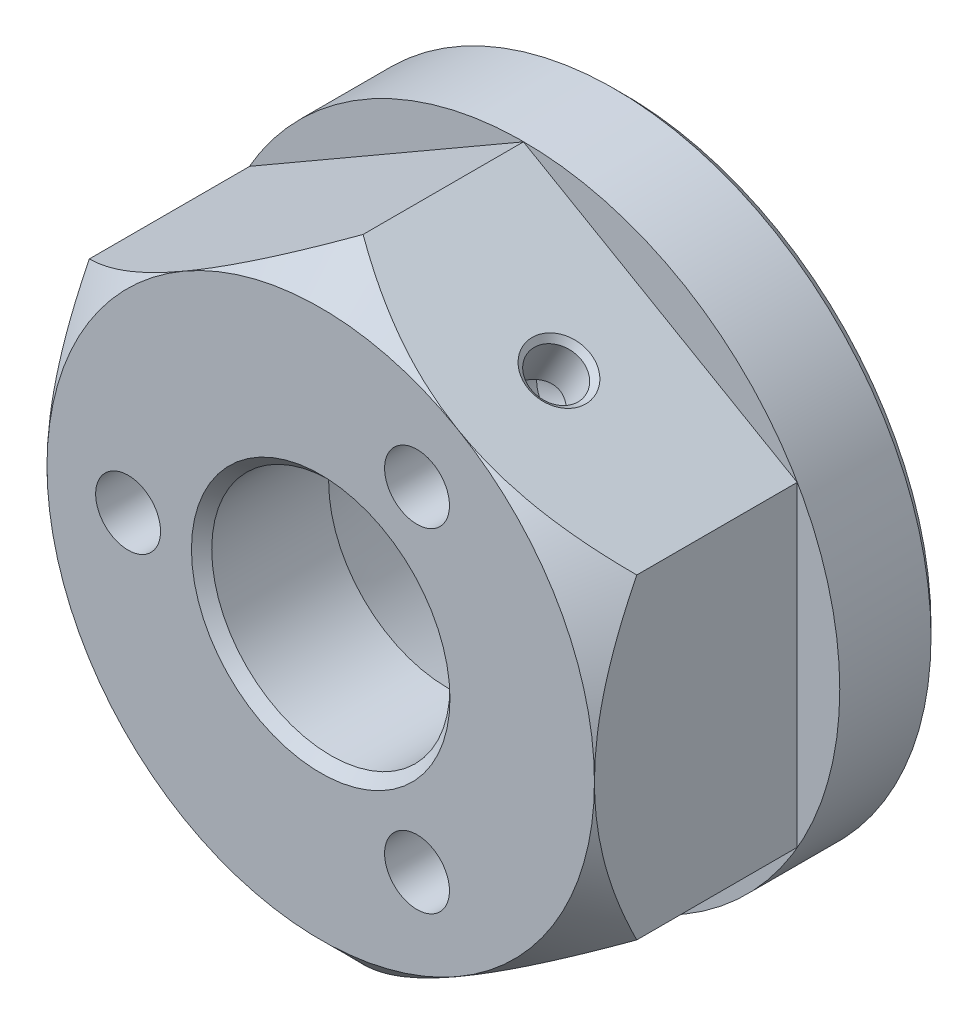
from build123d import *

# Parameters (mm, degrees)
ESQUISSE1_R                         = 15.6
ESQUISSE1_R_2                       = 10.25
BOSS_EXTRU_1_DEPTH                  = 5
ESQUISSE2_R                         = 15.6
ESQUISSE2_R_2                       = 5.875
BOSS_EXTRU_2_DEPTH                  = 10
CHANFREIN1_SIZE                     = 1
CHANFREIN1_SIZE2                    = 3.732050808
ENL_V_START                         = -10
ESQUISSE3_R                         = 15.6
ENL_V_MAT_EXTRU_1_DEPTH             = 10
CHANFREIN4_SIZE                     = 0.5
ESQUISSE15_R                        = 11.25
ENL_V_MAT_EXTRU_5_DEPTH             = 2.25
FILETAGE1_PITCH                     = 1.5
CHANFREIN9_SIZE                     = 0.5
CHANFREIN10_SIZE                    = 0.5
CHANFREIN10_SIZE2                   = 0.707106781
DIAM_TRE_DU_PER_AGE_3_2_3_2_1_D     = 3.2
DIAM_TRE_DU_PER_AGE_3_2_3_2_1_DEPTH = 7.5
DIAM_TRE_DU_PER_AGE_3_2_3_2_1_TIP   = 0.96137699


# Read off the part's stored shape, not the designer's step: Trou taraudé M3x0.51
with BuildPart() as part:
    # Esquisse1 → Boss.-Extru.1 (new body)
    with BuildSketch(Plane.XY):
        Circle(ESQUISSE1_R)
        Circle(ESQUISSE1_R_2, mode=Mode.SUBTRACT)
    extrude(amount=BOSS_EXTRU_1_DEPTH)

    # Esquisse2 → Boss.-Extru.2 (add)
    with BuildSketch(Plane.XY.offset(5)):
        Circle(ESQUISSE2_R)
        Circle(ESQUISSE2_R_2, mode=Mode.SUBTRACT)
    extrude(amount=BOSS_EXTRU_2_DEPTH)

    # Chanfrein1
    chanfrein1_edges = [part.edges().sort_by_distance(p)[0] for p in [
        (-5.875, 0, 5),
    ]]
    chanfrein1_side = [part.faces().sort_by_distance(p)[0] for p in [
        (-9.96008622, 0, 5),
    ]]
    chamfer(chanfrein1_edges, length=CHANFREIN1_SIZE, length2=CHANFREIN1_SIZE2, reference=chanfrein1_side[0])

    # Esquisse3 → Enlèv. mat.-Extru.1 (cut)
    with BuildSketch(Plane.XY.offset(15).offset(ENL_V_START)):
        Circle(ESQUISSE3_R)
        Polygon((-13.5, -7.794228634), (0, -15.588457268), (13.5, -7.794228634), (13.5, 7.794228634), (0, 15.588457268), (-13.5, 7.794228634), align=None, mode=Mode.SUBTRACT)
    extrude(amount=ENL_V_MAT_EXTRU_1_DEPTH, mode=Mode.SUBTRACT)

    # Chanfrein4
    chanfrein4_edges = [part.edges().sort_by_distance(p)[0] for p in [
        (-15.6, 0, 0),
    ]]
    chamfer(chanfrein4_edges, length=CHANFREIN4_SIZE)

    # Esquisse4 → Enlèvement de matière-Révolution1 (revolve, cut)
    with BuildSketch(Plane(origin=(0, 0, 0), x_dir=(0, 0, -1), z_dir=(1, 0, 0)), mode=Mode.PRIVATE) as enl_vement_de_mati_re_r_volution1_sk:
        Polygon((-15, 0), (-15, 13.5), (-12.911542732, 15.588457268), (-10.723673225, 15.588457268), (-10.723673225, 16.588457268), (-16, 16.588457268), (-16, 0), align=None)
    revolve(enl_vement_de_mati_re_r_volution1_sk.sketch.rotate(Axis((0, 0, 0), (0, 0, 1)), 90), axis=Axis((0, 0, 0), (0, 0, 1)), mode=Mode.SUBTRACT)

    # Esquisse15 → Enlèv. mat.-Extru.5 (cut)
    with BuildSketch(Plane(origin=(0, 0, 5), x_dir=(-1, 0, 0), z_dir=(0, 0, -1))):
        Circle(ESQUISSE15_R)
    extrude(amount=ENL_V_MAT_EXTRU_5_DEPTH, mode=Mode.SUBTRACT)

    # Filetage1: the profile of Profil de filetage1 profile screwed along a right-hand helix of 3.666667 turns, 8 arcs to a turn; built about Z, then put on its axis
    filetage1_z = Axis((0, 0, 0), (0, 0, 1))
    filetage1_corners = [(10.2497, 1e-09, -0.000173205), (11.061898813, 1e-09, 0.468749998), (11.061898813, 1e-09, 0.656249998), (10.2497, 1e-09, 1.125173201)]
    with BuildLine(mode=Mode.PRIVATE) as filetage1_profile:
        Line(filetage1_corners[0], filetage1_corners[1])
        Line(filetage1_corners[1], filetage1_corners[2])
        Line(filetage1_corners[2], filetage1_corners[3])
        Line(filetage1_corners[3], filetage1_corners[0])
    filetage1_cap = Face(filetage1_profile.wire())
    filetage1_turn_angles = [0, 22.5, 45, 67.5, 90, 112.5, 135, 157.5, 180, 202.5, 225, 247.5, 270, 292.5, 315, 337.5, 360]
    filetage1_turn_weights = [1, 0.9238795325112867, 1, 0.9238795325112867, 1, 0.9238795325112867, 1, 0.9238795325112867, 1, 0.9238795325112867, 1, 0.9238795325112867, 1, 0.9238795325112867, 1, 0.9238795325112867, 1]
    filetage1_turn_rails = [Edge.make_bspline([Vector(p[0], p[1], 0).rotate(filetage1_z, filetage1_turn_angles[k]) / filetage1_turn_weights[k] + Vector(0, 0, p[2] + FILETAGE1_PITCH * filetage1_turn_angles[k] / 360) for k in range(17)], [0, 0, 0, 1, 1, 2, 2, 3, 3, 4, 4, 5, 5, 6, 6, 7, 7, 8, 8, 8], 2, filetage1_turn_weights) for p in filetage1_corners]
    filetage1_turn_sides = [Face.make_surface_from_curves(filetage1_turn_rails[p[0]], filetage1_turn_rails[p[1]]) for p in [(0, 1), (1, 2), (2, 3), (3, 0)]]
    filetage1_last_angles = [1080, 1102.5, 1125, 1147.5, 1170, 1192.5, 1215, 1237.5, 1260, 1282.5, 1305, 1312.5, 1320]
    filetage1_last_weights = [1, 0.9238795325112867, 1, 0.9238795325112867, 1, 0.9238795325112867, 1, 0.9238795325112867, 1, 0.9238795325112867, 1, 0.9914448613738107, 1]
    filetage1_last_rails = [Edge.make_bspline([Vector(p[0], p[1], 0).rotate(filetage1_z, filetage1_last_angles[k]) / filetage1_last_weights[k] + Vector(0, 0, p[2] + FILETAGE1_PITCH * filetage1_last_angles[k] / 360) for k in range(13)], [0, 0, 0, 1, 1, 2, 2, 3, 3, 4, 4, 5, 5, 6, 6, 6], 2, filetage1_last_weights) for p in filetage1_corners]
    filetage1_last_sides = [Face.make_surface_from_curves(filetage1_last_rails[p[0]], filetage1_last_rails[p[1]]) for p in [(0, 1), (1, 2), (2, 3), (3, 0)]]
    filetage1 = Plane(origin=(0, 0, -2), x_dir=(0.5, -0.866025404, 0), z_dir=(0, 0, 1)) * Solid(Shell([*[p.moved(Location((0, 0, FILETAGE1_PITCH * i))) for i in range(3) for p in filetage1_turn_sides], *filetage1_last_sides, filetage1_cap, filetage1_cap.rotate(filetage1_z, 1320).moved(Location((0, 0, FILETAGE1_PITCH * 1320 / 360)))]))
    add(filetage1, mode=Mode.SUBTRACT)

    # Chanfrein9
    chanfrein9_edges = [part.edges().sort_by_distance(p)[0] for p in [
        (-5.875, 0, 15),
    ]]
    chamfer(chanfrein9_edges, length=CHANFREIN9_SIZE)

    # Chanfrein10
    chanfrein10_edges = [part.edges().sort_by_distance(p)[0] for p in [
        (-6.875, 0, 5),
    ]]
    chanfrein10_side = [part.faces().sort_by_distance(p)[0] for p in [
        (-6.375, 0, 6.866025404),
    ]]
    chamfer(chanfrein10_edges, length=CHANFREIN10_SIZE, length2=CHANFREIN10_SIZE2, reference=chanfrein10_side[0])

    # Diamètre du perçage Ø3.2 (3.2)1
    with Locations(Plane(origin=(-9.5, 0, 15), x_dir=(1, 0, 0), z_dir=(0, 0, 1))):
        with Locations((0, 0), (14.25, 8.227241336), (14.25, -8.227241336)):
            Hole(DIAM_TRE_DU_PER_AGE_3_2_3_2_1_D / 2, depth=DIAM_TRE_DU_PER_AGE_3_2_3_2_1_DEPTH)
            with Locations((0, 0, -(DIAM_TRE_DU_PER_AGE_3_2_3_2_1_DEPTH + DIAM_TRE_DU_PER_AGE_3_2_3_2_1_TIP / 2))):  # 118° drill point
                Cone(0, DIAM_TRE_DU_PER_AGE_3_2_3_2_1_D / 2, DIAM_TRE_DU_PER_AGE_3_2_3_2_1_TIP, mode=Mode.SUBTRACT)

    # Trou taraudé M3x0.51 outline → Trou taraudé M3x0.51 (revolve, cut)
    with BuildSketch(Plane(origin=(0, 0, 10), x_dir=(0.8660254037844384, 0.5000000000000003, 0), z_dir=(0, 0, -1))):
        Polygon((0, 10.498379709), (1.25, 10.498379709), (1.25, 13.225), (1.525, 13.5), (0, 13.5), align=None)
    revolve(axis=Axis((0, 0, 10), (0.5000000000000003, -0.8660254037844384, 0)), mode=Mode.SUBTRACT)

    # Trou taraud_ M3x0.51 2 outline → Trou taraud_ M3x0.51 2 (revolve, cut)
    with BuildSketch(Plane(origin=(0, 0, 10), x_dir=(0.8660254037844386, -0.4999999999999999, 0), z_dir=(0, 0, 1))):
        Polygon((0, 10.498379709), (1.25, 10.498379709), (1.25, 13.225), (1.525, 13.5), (0, 13.5), align=None)
    revolve(axis=Axis((0, 0, 10), (0.4999999999999999, 0.8660254037844386, 0)), mode=Mode.SUBTRACT)

    # Trou taraud_ M3x0.51 3 outline → Trou taraud_ M3x0.51 3 (revolve, cut)
    with BuildSketch(Plane.YX.offset(-10)):
        Polygon((1.25, -13.225), (1.25, -10.498395783), (0, -10.498395783), (0, -13.5), (1.525, -13.5), align=None)
    revolve(axis=Axis((0, 0, 10), (1, 0, 0)), mode=Mode.SUBTRACT)


solid = part.part
